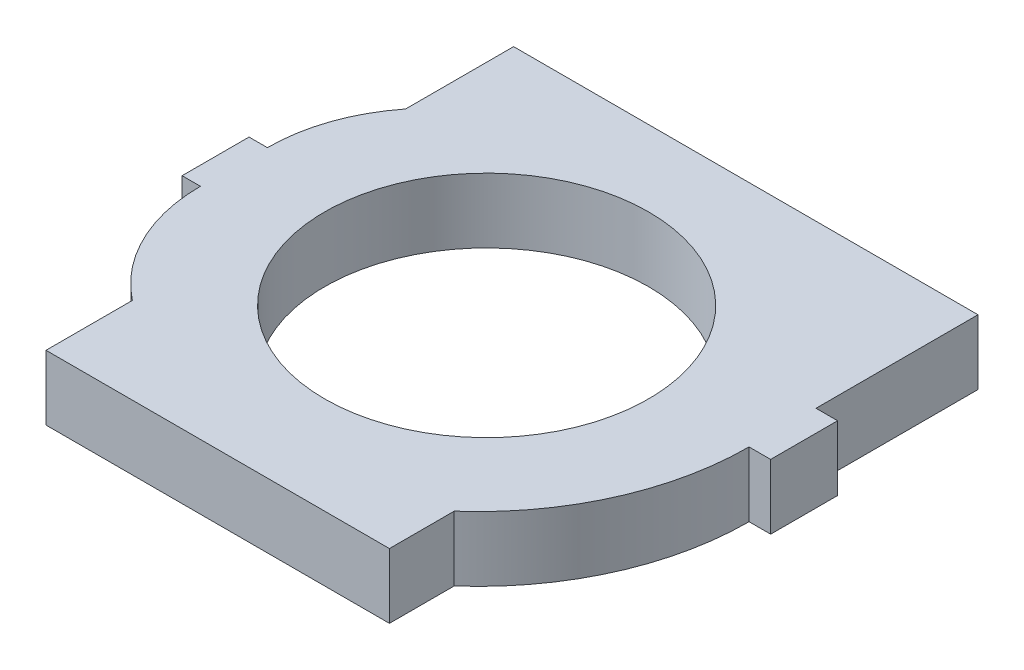
from build123d import *

# Parameters (mm, degrees)
SKETCH1_W           = 62.8
SKETCH1_H           = 46
SKETCH1_R           = 1.4
SKETCH1_R_2         = 15
BOSS_EXTRUDE1_DEPTH = 6
SKETCH2_W           = 8.5
SKETCH2_H           = 15
CUT_EXTRUDE1_DEPTH  = 41.459856648
FILLET1_R           = 3.1
CUT_EXTRUDE2_DEPTH  = 41.459856648


with BuildPart() as part:
    # Sketch1 → Boss-Extrude1 (new body)
    with BuildSketch(Plane(origin=(0, 0, 0), x_dir=(1, 0, 0), z_dir=(0, 1, 0))):
        with Locations((0, -1.8)):
            Rectangle(SKETCH1_W, SKETCH1_H)
        with Locations(Location((-28.3, -1.4, 0), (0, 0, 270))):
            Circle(SKETCH1_R, mode=Mode.SUBTRACT)
        with Locations(Location((28.3, 3.1, 0), (0, 0, 270))):
            Circle(SKETCH1_R, mode=Mode.SUBTRACT)
        with Locations(Location((-0.6, -0.8, 0), (0, 0, 270))):
            Circle(SKETCH1_R_2, mode=Mode.SUBTRACT)
    extrude(amount=BOSS_EXTRUDE1_DEPTH)

    # Sketch2 → Cut-Extrude1 (cut, through all)
    with BuildSketch(Plane(origin=(0, 6, 0), x_dir=(1, 0, 0), z_dir=(0, 1, 0))):
        with Locations((27.15, 13.7)):
            Rectangle(SKETCH2_W, SKETCH2_H)
        with BuildLine():
            Line((14.4, -24.8), (31.4, -24.8))
            Line((31.4, -24.8), (31.4, 0))
            Line((31.4, 0), (22.9, 0))
            ThreePointArc((22.9, 0), (20.676259907, -10.31612815), (14.4, -18.8))
            Line((14.4, -18.8), (14.4, -24.8))
        make_face()
        with BuildLine():
            Line((-17.4, -24.8), (-17.4, -16.8))
            ThreePointArc((-17.4, -16.8), (-21.820028515, -11.342696837), (-23.4, -4.5))
            Line((-23.4, -4.5), (-31.4, -4.5))
            Line((-31.4, -4.5), (-31.4, -24.8))
            Line((-31.4, -24.8), (-17.4, -24.8))
        make_face()
        with BuildLine():
            Line((-20.1, 21.2), (-20.1, 11.2))
            ThreePointArc((-20.1, 11.2), (-22.551509918, 6.728419235), (-23.4, 1.7))
            Line((-23.4, 1.7), (-31.4, 1.7))
            Line((-31.4, 1.7), (-31.4, 21.2))
            Line((-31.4, 21.2), (-20.1, 21.2))
        make_face()
    extrude(amount=-CUT_EXTRUDE1_DEPTH, mode=Mode.SUBTRACT)

    # Fillet1
    fillet1_edges = [part.edges().sort_by_distance(p)[0] for p in [
        (-31.4, 3, 4.5),
        (-31.4, 3, -1.7),
        (31.4, 3, -6.2),
        (31.4, 3, 0),
    ]]
    fillet(fillet1_edges, radius=FILLET1_R - 0.0001)  # a hair under: the kernel refuses the full size

    # Sketch3 → Cut-Extrude2 (cut, through all)
    with BuildSketch(Plane(origin=(0, 6, 0), x_dir=(1, 0, 0), z_dir=(0, 1, 0))):
        with BuildLine():
            Line((28.3, 0), (24.9, 0))
            Line((24.9, 0), (24.9, 6.2))
            Line((24.9, 6.2), (28.3, 6.2))
            ThreePointArc((28.3, 6.2), (30.492031022, 5.292031022), (31.4, 3.1))
            ThreePointArc((31.4, 3.1), (30.492031022, 0.907968978), (28.3, 0))
        make_face()
        with BuildLine():
            Line((-25.1, -4.5), (-28.3, -4.5))
            ThreePointArc((-28.3, -4.5), (-30.492031022, -3.592031022), (-31.4, -1.4))
            ThreePointArc((-31.4, -1.4), (-30.492031022, 0.792031022), (-28.3, 1.7))
            Line((-28.3, 1.7), (-25.1, 1.7))
            Line((-25.1, 1.7), (-25.1, -4.5))
        make_face()
    extrude(amount=-CUT_EXTRUDE2_DEPTH, mode=Mode.SUBTRACT)


with BuildPart() as cut_extrude2_kept_piece:
    # of the separate pieces the step leaves, the one the design keeps (cut_extrude2_pieces_kept)
    add(part.part.solids().sort_by_distance((-23.4, 0, 4.5))[0])


solid = cut_extrude2_kept_piece.part
